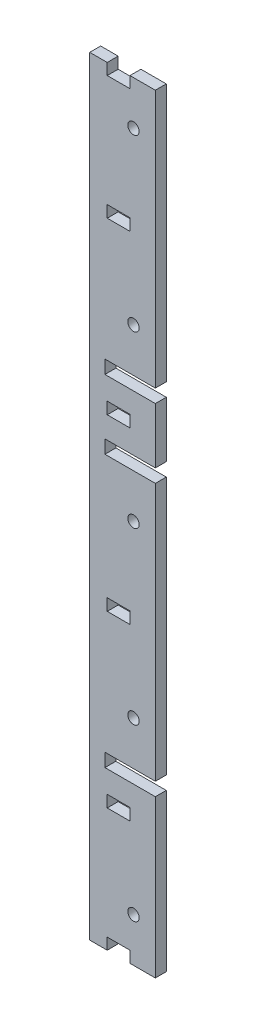
from build123d import *

# Parameters (mm, degrees)
SKETCH1_W             = 38.1
SKETCH1_H             = 498.348
SKETCH1_R             = 3
BOSS_EXTRUDE1_DEPTH   = 6.35
M6_CLEARANCE_HOLE1_D  = 6.6
LPATTERN1_COUNT       = 3
LPATTERN1_PITCH       = 98.8568
LPATTERN1_COL_COUNT   = 3
LPATTERN1_COL_PITCH   = 98.8568
SKETCH4_W             = 26.9875
SKETCH4_H             = 3.175
SKETCH4_W_2           = 25.7175
CUT_EXTRUDE1_DEPTH    = 250.981813891
LPATTERN2_START       = -8.887219794
LPATTERN2_OUTLINE_W   = 6.858
LPATTERN2_OUTLINE_H   = 6.35
LPATTERN2_OUTLINE_W_2 = 6.604
LPATTERN2_DEPTH       = 13.208


# Read off the part's stored shape, not the designer's step: LPattern2
with BuildPart() as part:
    # Sketch1 → Boss-Extrude1 (new body)
    with BuildSketch(Plane.XY):
        Rectangle(SKETCH1_W, SKETCH1_H)
        with Locations((6.35, 0)):
            Circle(SKETCH1_R, mode=Mode.SUBTRACT)
    extrude(amount=BOSS_EXTRUDE1_DEPTH)

    # M6 Clearance Hole1 (through all)
    with Locations(Plane.XY.offset(6.35)):
        with Locations((6.35, 0)):
            m6_clearance_hole1 = Hole(M6_CLEARANCE_HOLE1_D / 2)

    # LPattern1: M6 Clearance Hole1 ×3
    with Locations(*[(0, -i * LPATTERN1_PITCH, 0) for i in range(1, LPATTERN1_COUNT)]):
        add(m6_clearance_hole1, mode=Mode.SUBTRACT)

    # LPattern1 col: M6 Clearance Hole1 ×3
    with Locations(*[(0, i * LPATTERN1_COL_PITCH, 0) for i in range(1, LPATTERN1_COL_COUNT)]):
        add(m6_clearance_hole1, mode=Mode.SUBTRACT)

    # Sketch4 → Cut-Extrude1 (cut, through all)
    with BuildSketch(Plane.XY.offset(6.35)):
        Polygon((-8.9535, -231.0064), (-8.9535, -223.2594), (-19.05, -223.2594), (-19.05, -249.174), (19.05, -249.174), (19.05, -231.0064), align=None)
        Polygon((19.05, -225.5454), (19.05, -223.2594), (-8.9535, -223.2594), (-8.9535, -231.0064), (19.05, -231.0064), (19.05, -228.7204), (-6.6675, -228.7204), (-6.6675, -225.5454), align=None)
        with Locations((5.55625, -128.2159)):
            Rectangle(SKETCH4_W, SKETCH4_H)
        Polygon((-10.2235, -132.0894), (19.05, -132.0894), (19.05, -129.8034), (-7.9375, -129.8034), (-7.9375, -126.6284), (19.05, -126.6284), (19.05, -124.3424), (-10.2235, -124.3424), align=None)
        with Locations((6.19125, -227.1329)):
            Rectangle(SKETCH4_W_2, SKETCH4_H)
        with Locations((5.55625, 29.3591)):
            Rectangle(SKETCH4_W, SKETCH4_H)
        Polygon((-10.2235, 25.4856), (19.05, 25.4856), (19.05, 27.7716), (-7.9375, 27.7716), (-7.9375, 30.9466), (19.05, 30.9466), (19.05, 33.2326), (-10.2235, 33.2326), align=None)
        Polygon((19.05, 71.0852), (19.05, 73.3712), (-10.2235, 73.3712), (-10.2235, 65.6242), (19.05, 65.6242), (19.05, 67.9102), (-7.9375, 67.9102), (-7.9375, 71.0852), align=None)
        with Locations((5.55625, 69.4977)):
            Rectangle(SKETCH4_W, SKETCH4_H)
        Polygon((-19.05, 249.174), (-19.05, 223.1992), (-10.2235, 223.1992), (-10.2235, 230.9462), (19.05, 230.9462), (19.05, 249.174), align=None)
        with Locations((5.55625, 227.0727)):
            Rectangle(SKETCH4_W, SKETCH4_H)
        Polygon((-10.2235, 230.9462), (-10.2235, 223.1992), (19.05, 223.1992), (19.05, 225.4852), (-7.9375, 225.4852), (-7.9375, 228.6602), (19.05, 228.6602), (19.05, 230.9462), align=None)
    extrude(amount=-CUT_EXTRUDE1_DEPTH, mode=Mode.SUBTRACT)

    # LPattern2 outline → LPattern2 (cut)
    with BuildSketch(Plane.YZ.offset(LPATTERN2_START)):
        with Locations((148.2852, 3.175)):
            Rectangle(LPATTERN2_OUTLINE_W, LPATTERN2_OUTLINE_H)
        with Locations((219.8972, 3.175)):
            Rectangle(LPATTERN2_OUTLINE_W_2, LPATTERN2_OUTLINE_H)
        with Locations((49.4284, 3.175)):
            Rectangle(LPATTERN2_OUTLINE_W, LPATTERN2_OUTLINE_H)
        with Locations((-49.4284, 3.175)):
            Rectangle(LPATTERN2_OUTLINE_W, LPATTERN2_OUTLINE_H)
        with Locations((-148.2852, 3.175)):
            Rectangle(LPATTERN2_OUTLINE_W, LPATTERN2_OUTLINE_H)
        with Locations((-219.9574, 3.175)):
            Rectangle(LPATTERN2_OUTLINE_W_2, LPATTERN2_OUTLINE_H)
    extrude(amount=LPATTERN2_DEPTH, mode=Mode.SUBTRACT)


solid = part.part
